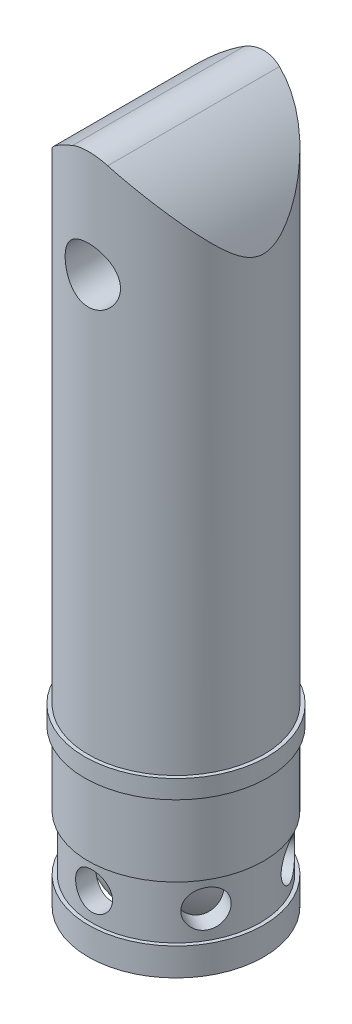
from build123d import *

# Parameters (mm, degrees)
SKETCH2_R               = 4.75
BOSS_EXTRUDE2_DEPTH     = 38
CUT_EXTRUDE1_DEPTH      = 39.589182422
CUT_EXTRUDE1_DEPTH_BACK = 39.589182422
FILLET1_R               = 2
SKETCH4_R               = 1
CUT_EXTRUDE2_DEPTH      = 39.395631189
CIRPATTERN1_COUNT       = 3
SKETCH5_W               = 0.2
SKETCH5_H               = 1
SKETCH6_W               = 0.2
SKETCH6_H               = 3
CUT_EXTRUDE3_DEPTH      = 39.446124545
CUT_EXTRUDE3_DEPTH_BACK = 39.446124545
SKETCH9_R               = 1.5


with BuildPart() as part:
    # Sketch2 → Boss-Extrude2 (new body)
    with BuildSketch(Plane(origin=(0, 0, 0), x_dir=(1, 0, 0), z_dir=(0, 1, 0))):
        with Locations(Location((0, 0, 0), (0, 0, 270))):
            Circle(SKETCH2_R)
    extrude(amount=BOSS_EXTRUDE2_DEPTH)

    # Sketch3 → Cut-Extrude1 (cut, two sides: drawn at the far end of the back side and taken through both)
    with BuildSketch(Plane.XY.offset(-CUT_EXTRUDE1_DEPTH_BACK)):
        with BuildLine():
            ThreePointArc((-4.75, 33), (-2.941454847, 36.038132105), (0, 38))
            Line((0, 38), (-4.75, 38))
            Line((-4.75, 38), (-4.75, 33))
        make_face()
        with BuildLine():
            Line((4.75, 33), (4.75, 38))
            Line((4.75, 38), (0, 38))
            ThreePointArc((0, 38), (2.941454847, 36.038132105), (4.75, 33))
        make_face()
    extrude(amount=CUT_EXTRUDE1_DEPTH + CUT_EXTRUDE1_DEPTH_BACK, mode=Mode.SUBTRACT)

    # Fillet1
    # the kernel refuses this fillet: 2 mm, written as the material it takes off along each edge
    with BuildSketch(Plane(origin=(0, 38, -7.371879363), x_dir=(-0.9085533140310261, -0.4177689260383537, 0), z_dir=(0, 0, 1))) as fillet1_piece_1:
        with BuildLine():
            CenterArc((0.917657777, 1.995698968), FILLET1_R, 216.854119223, 56.904140777)
            ThreePointArc((-0.682672625, 0.79613963), (-0.354396493, 0.386870991), (0, 0))
            ThreePointArc((0, 0), (0.524375873, -0.017204127), (1.048751745, 0))
        make_face()
    extrude(amount=14.743758727, mode=Mode.SUBTRACT)

    # Sketch4 → Cut-Extrude2 (cut, symmetric)
    with BuildSketch(Plane.XY):
        with Locations((0, 3)):
            Circle(SKETCH4_R)
    cut_extrude2 = extrude(amount=CUT_EXTRUDE2_DEPTH, both=True, mode=Mode.SUBTRACT)

    # CirPattern1: Cut-Extrude2 ×3 about axis
    cirpattern1_axis = Axis((0, 0, 0), (0, 1, 0))
    for i in range(1, CIRPATTERN1_COUNT):
        add(cut_extrude2.rotate(cirpattern1_axis, i * 360 / CIRPATTERN1_COUNT), mode=Mode.SUBTRACT)

    # Sketch5 → Revolve1 (revolve)
    with BuildSketch(Plane.XY):
        with Locations((4.85, 9)):
            Rectangle(SKETCH5_W, SKETCH5_H)
    revolve(axis=Axis((0, 0, 0), (0, 1, 0)))

    # Sketch6 → Cut-Revolve1 (revolve, cut)
    with BuildSketch(Plane.XY):
        with Locations((4.65, 3)):
            Rectangle(SKETCH6_W, SKETCH6_H)
    revolve(axis=Axis((0, 0, 0), (0, 1, 0)), mode=Mode.SUBTRACT)

    # Sketch7 → Cut-Revolve2 (revolve, cut)
    with BuildSketch(Plane.XY, mode=Mode.PRIVATE) as cut_revolve2_sk:
        Polygon((0, 0), (0, 7), (3.5, 7), (3.5, 2), (4.25, 0), align=None)
    revolve(cut_revolve2_sk.sketch.rotate(Axis((0, 0, 0), (0, 1, 0)), 90), axis=Axis((0, 0, 0), (0, 1, 0)), mode=Mode.SUBTRACT)

    # Sketch8 → Revolve2 (revolve)
    with BuildSketch(Plane.XY):
        with BuildLine():
            Line((0, 0), (0, 7))
            Line((0, 7), (3.5, 7))
            Line((3.5, 7), (3.5, 3.5))
            ThreePointArc((3.5, 3.5), (2.474873734, 1.025126266), (0, 0))
        make_face()
    revolve(axis=Axis((0, 0, 0), (0, 1, 0)))

    # Sketch9 → Cut-Extrude3 (cut, two sides: drawn at the far end of the back side and taken through both)
    with BuildSketch(Plane.XY.offset(-CUT_EXTRUDE3_DEPTH_BACK)):
        with Locations((0, 32)):
            Circle(SKETCH9_R)
    extrude(amount=CUT_EXTRUDE3_DEPTH + CUT_EXTRUDE3_DEPTH_BACK, mode=Mode.SUBTRACT)


solid = part.part
